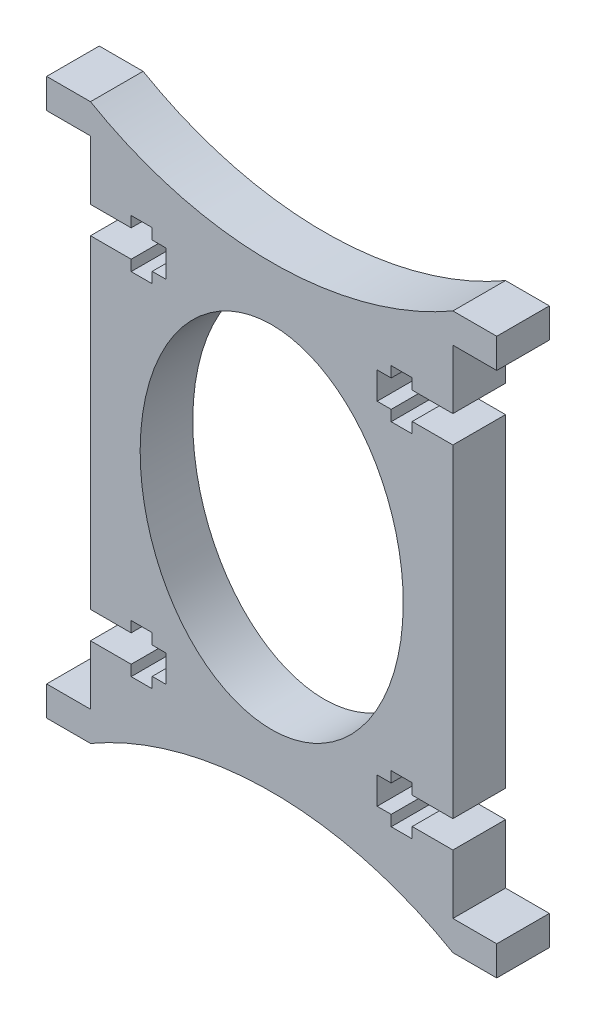
from build123d import *

# Parameters (mm, degrees)
SKETCH1_RX          = 20
SKETCH1_RY          = 15
BOSS_EXTRUDE1_DEPTH = 6


with BuildPart() as part:
    # Sketch1 → Boss-Extrude1 (new body)
    with BuildSketch(Plane.XY):
        with BuildLine():
            Line((735.144762029, 436.653824982), (737.544762029, 436.653824982))
            Line((737.544762029, 436.653824982), (737.544762029, 437.878226994))
            Line((737.544762029, 437.878226994), (742.182967056, 437.878226994))
            Line((742.182967056, 437.878226994), (742.182967056, 431.116067))
            Line((742.182967056, 431.116067), (747.182967056, 431.116067))
            Line((747.182967056, 431.116067), (747.182967056, 427.736067))
            Line((747.182967056, 427.736067), (742.182967056, 427.736067))
            ThreePointArc((742.182967056, 427.736067), (721.518527083, 433.280029226), (700.85408711, 427.736067))
            Line((700.85408711, 427.736067), (695.85408711, 427.736067))
            Line((695.85408711, 427.736067), (695.85408711, 431.116067))
            Line((695.85408711, 431.116067), (700.85408711, 431.116067))
            Line((700.85408711, 431.116067), (700.85408711, 437.878226994))
            Line((700.85408711, 437.878226994), (705.492292137, 437.878226994))
            Line((705.492292137, 437.878226994), (705.492292137, 436.653824982))
            Line((705.492292137, 436.653824982), (707.892292137, 436.653824982))
            Line((707.892292137, 436.653824982), (707.892292137, 437.878226994))
            Line((707.892292137, 437.878226994), (709.492292137, 437.878226994))
            Line((709.492292137, 437.878226994), (709.492292137, 440.973907006))
            Line((709.492292137, 440.973907006), (707.892292137, 440.973907006))
            Line((707.892292137, 440.973907006), (707.892292137, 442.198309018))
            Line((707.892292137, 442.198309018), (705.492292137, 442.198309018))
            Line((705.492292137, 442.198309018), (705.492292137, 440.973907006))
            Line((705.492292137, 440.973907006), (700.85408711, 440.973907006))
            Line((700.85408711, 440.973907006), (700.85408711, 459.426067))
            Line((700.85408711, 459.426067), (700.85408711, 477.878226994))
            Line((700.85408711, 477.878226994), (705.492292137, 477.878226994))
            Line((705.492292137, 477.878226994), (705.492292137, 476.653824982))
            Line((705.492292137, 476.653824982), (707.892292137, 476.653824982))
            Line((707.892292137, 476.653824982), (707.892292137, 477.878226994))
            Line((707.892292137, 477.878226994), (709.492292137, 477.878226994))
            Line((709.492292137, 477.878226994), (709.492292137, 480.973907006))
            Line((709.492292137, 480.973907006), (707.892292137, 480.973907006))
            Line((707.892292137, 480.973907006), (707.892292137, 482.198309018))
            Line((707.892292137, 482.198309018), (705.492292137, 482.198309018))
            Line((705.492292137, 482.198309018), (705.492292137, 480.973907006))
            Line((705.492292137, 480.973907006), (700.85408711, 480.973907006))
            Line((700.85408711, 480.973907006), (700.85408711, 487.736067))
            Line((700.85408711, 487.736067), (695.85408711, 487.736067))
            Line((695.85408711, 487.736067), (695.85408711, 491.116067))
            Line((695.85408711, 491.116067), (700.85408711, 491.116067))
            ThreePointArc((700.85408711, 491.116067), (721.518527083, 485.572104773), (742.182967056, 491.116067))
            Line((742.182967056, 491.116067), (747.182967056, 491.116067))
            Line((747.182967056, 491.116067), (747.182967056, 487.736067))
            Line((747.182967056, 487.736067), (742.182967056, 487.736067))
            Line((742.182967056, 487.736067), (742.182967056, 480.973907006))
            Line((742.182967056, 480.973907006), (737.544762029, 480.973907006))
            Line((737.544762029, 480.973907006), (737.544762029, 482.198309018))
            Line((737.544762029, 482.198309018), (735.144762029, 482.198309018))
            Line((735.144762029, 482.198309018), (735.144762029, 480.973907006))
            Line((735.144762029, 480.973907006), (733.544762029, 480.973907006))
            Line((733.544762029, 480.973907006), (733.544762029, 477.878226994))
            Line((733.544762029, 477.878226994), (735.144762029, 477.878226994))
            Line((735.144762029, 477.878226994), (735.144762029, 476.653824982))
            Line((735.144762029, 476.653824982), (737.544762029, 476.653824982))
            Line((737.544762029, 476.653824982), (737.544762029, 477.878226994))
            Line((737.544762029, 477.878226994), (742.182967056, 477.878226994))
            Line((742.182967056, 477.878226994), (742.182967056, 459.426067))
            Line((742.182967056, 459.426067), (742.182967056, 440.973907006))
            Line((742.182967056, 440.973907006), (737.544762029, 440.973907006))
            Line((737.544762029, 440.973907006), (737.544762029, 442.198309018))
            Line((737.544762029, 442.198309018), (735.144762029, 442.198309018))
            Line((735.144762029, 442.198309018), (735.144762029, 440.973907006))
            Line((735.144762029, 440.973907006), (733.544762029, 440.973907006))
            Line((733.544762029, 440.973907006), (733.544762029, 437.878226994))
            Line((733.544762029, 437.878226994), (735.144762029, 437.878226994))
            Line((735.144762029, 437.878226994), (735.144762029, 436.653824982))
        make_face()
        with Locations(Location((721.518527083, 459.426067), (0, 0, 90))):
            Ellipse(SKETCH1_RX, SKETCH1_RY, mode=Mode.SUBTRACT)
    extrude(amount=BOSS_EXTRUDE1_DEPTH)


solid = part.part
